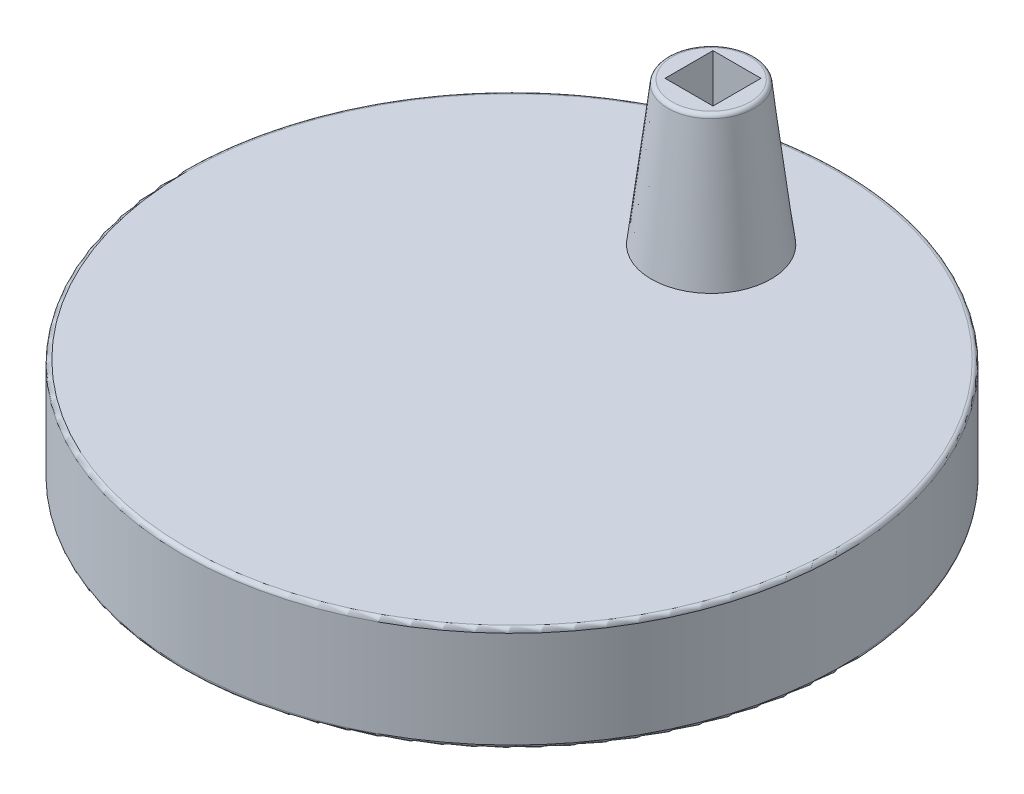
from build123d import *

# Parameters (mm, degrees)
SKETCH2_R           = 80.35
BOSS_EXTRUDE1_DEPTH = 25.6
SKETCH4_R           = 14.6
SKETCH6_R           = 10.4
CUT_EXTRUDE1_DEPTH  = 25.6
FILLET1_R           = 1
FILLET2_R           = 1
SKETCH15_R          = 1.7500000000000007
CUT_EXTRUDE3_DEPTH  = 162.09555208012418
THREAD2_PITCH       = 0.5


with BuildPart() as part:
    # Sketch2 → Boss-Extrude1 (new body)
    with BuildSketch(Plane(origin=(0, 0, 0), x_dir=(1, 0, 0), z_dir=(0, 1, 0))):
        with Locations(Location((0, 0, 0), (0, 0, 270))):
            Circle(SKETCH2_R)
    extrude(amount=-BOSS_EXTRUDE1_DEPTH)

    # Sketch4 → Loft1 section 0
    with BuildSketch(Plane(origin=(0, 0, 0), x_dir=(1, 0, 0), z_dir=(0, 1, 0))):
        with Locations((0, 48.55000000000001)):
            Circle(SKETCH4_R)
    # Sketch6 → Loft1 section 1
    with BuildSketch(Plane(origin=(0, 34.88, 0), x_dir=(1, 0, 0), z_dir=(0, 1, 0))):
        with Locations((0, 48.55000000000001)):
            Circle(SKETCH6_R)
    loft()

    # Sketch7 → Cut-Extrude1 (cut)
    with BuildSketch(Plane(origin=(0, 34.88, 0), x_dir=(1, 0, 0), z_dir=(0, 1, 0))):
        Polygon((-5.85, 43.15000000000002), (5.8500000000000005, 43.15000000000002), (5.85, 54.850000000000016), (-5.85, 54.850000000000016), align=None)
    extrude(amount=-CUT_EXTRUDE1_DEPTH, mode=Mode.SUBTRACT)

    # Fillet1
    fillet1_edges = [part.edges().sort_by_distance(p)[0] for p in [
        (-10.4, 34.88, -48.55000000000001),
    ]]
    fillet(fillet1_edges, radius=FILLET1_R)

    # Fillet2
    fillet2_edges = [part.edges().sort_by_distance(p)[0] for p in [
        (2.46e-14, 0, -80.35),
        (2.46e-14, -25.6, -80.35),
    ]]
    fillet(fillet2_edges, radius=FILLET2_R)

    # Sketch15 → Cut-Extrude3 (cut, through all)
    with BuildSketch(Plane.XY.offset(-54.850000000000016)):
        with Locations((0, 24)):
            Circle(SKETCH15_R)
    extrude(amount=-CUT_EXTRUDE3_DEPTH, mode=Mode.SUBTRACT)

    # Thread2: the profile of Thread Profile3 profile screwed along a right-hand helix of 11 turns, 6 arcs to a turn; built about Z, then put on its axis
    thread2_z = Axis((0, 0, 0), (0, 0, 1))
    thread2_corners = [(1.7503, 0, -0.000173205), (1.7503, 0, 0.437673204), (1.479367063, 0, 0.281249999), (1.479367063, 0, 0.156249999)]
    with BuildLine(mode=Mode.PRIVATE) as thread2_profile:
        Line(thread2_corners[0], thread2_corners[1])
        Line(thread2_corners[1], thread2_corners[2])
        Line(thread2_corners[2], thread2_corners[3])
        Line(thread2_corners[3], thread2_corners[0])
    thread2_cap = Face(thread2_profile.wire())
    thread2_turn_angles = [0, 30, 60, 90, 120, 150, 180, 210, 240, 270, 300, 330, 360]
    thread2_turn_weights = [1, 0.8660254037844387, 1, 0.8660254037844387, 1, 0.8660254037844387, 1, 0.8660254037844387, 1, 0.8660254037844387, 1, 0.8660254037844387, 1]
    thread2_turn_rails = [Edge.make_bspline([Vector(p[0], p[1], 0).rotate(thread2_z, thread2_turn_angles[k]) / thread2_turn_weights[k] + Vector(0, 0, p[2] + THREAD2_PITCH * thread2_turn_angles[k] / 360) for k in range(13)], [0, 0, 0, 1, 1, 2, 2, 3, 3, 4, 4, 5, 5, 6, 6, 6], 2, thread2_turn_weights) for p in thread2_corners]
    thread2_turn_sides = [Face.make_surface_from_curves(thread2_turn_rails[p[0]], thread2_turn_rails[p[1]]) for p in [(0, 1), (1, 2), (2, 3), (3, 0)]]
    thread2 = Plane(origin=(0, 24, -54.85), x_dir=(-1, 0, 0), z_dir=(0, 0, -1)) * Solid(Shell([*[p.moved(Location((0, 0, THREAD2_PITCH * i))) for i in range(11) for p in thread2_turn_sides], thread2_cap, thread2_cap.rotate(thread2_z, 3960).moved(Location((0, 0, THREAD2_PITCH * 3960 / 360)))]))
    add(thread2)


solid = part.part
